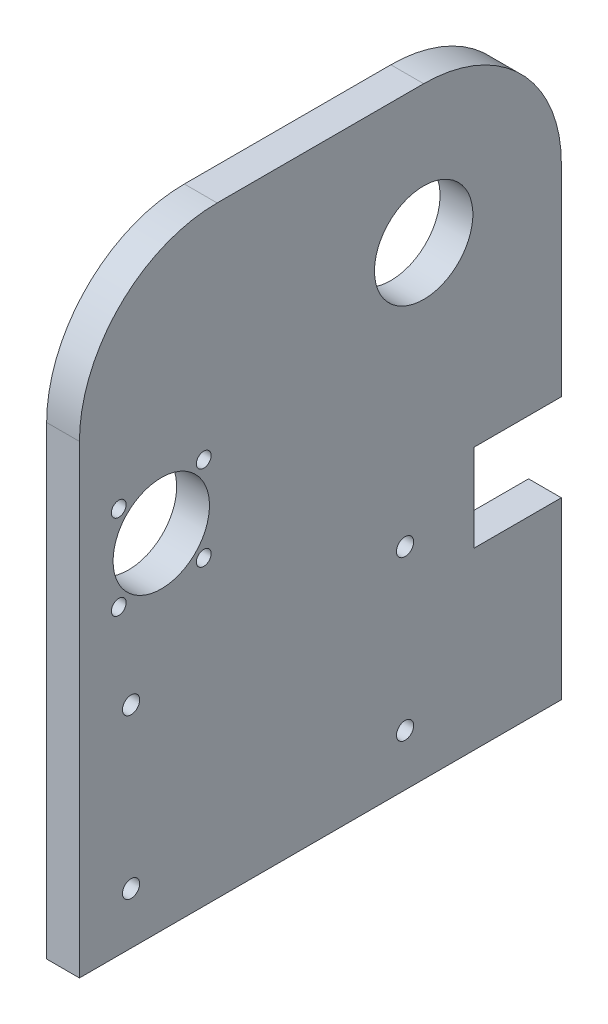
from build123d import *

# Parameters (mm, degrees)
SKETCH1_W             = 9.525
SKETCH1_H             = 140
BOSS_EXTRUDE1_DEPTH   = 87.5
SKETCH3_R             = 14.29
SKETCH3_R_2           = 2.15
SKETCH3_R_3           = 14
CUT_EXTRUDE2_DEPTH    = 28.575
SKETCH5_W             = 25.4
SKETCH5_H             = 25.4
CUT_EXTRUDE4_DEPTH    = 113.458773001
M6_TAPPED_HOLE1_D     = 5
M6_TAPPED_HOLE1_DEPTH = 10
M6_TAPPED_HOLE1_TIP   = 1.502151548
M6_TAPPED_HOLE2_D     = 5
FILLET1_R             = 40


with BuildPart() as part:
    # Sketch1 → Boss-Extrude1 (new, symmetric)
    with BuildSketch(Plane(origin=(0, 0, 0), x_dir=(1, 0, 0), z_dir=(0, 1, 0))):
        Rectangle(SKETCH1_W, SKETCH1_H)
    extrude(amount=BOSS_EXTRUDE1_DEPTH, both=True)

    # Sketch3 → Cut-Extrude2 (cut)
    with BuildSketch(Plane.ZY.offset(4.7625)):
        with Locations((-30, 47.5)):
            Circle(SKETCH3_R)
        with Locations((33.881108209, 24.847852166)):
            Circle(SKETCH3_R_2)
        with Locations((58.576812542, 24.847852166)):
            Circle(SKETCH3_R_2)
        with Locations((33.881108209, 0.152147834)):
            Circle(SKETCH3_R_2)
        with Locations((58.576812542, 0.152147834)):
            Circle(SKETCH3_R_2)
        with Locations((46.228960376, 12.5)):
            Circle(SKETCH3_R_3)
    extrude(amount=-CUT_EXTRUDE2_DEPTH, mode=Mode.SUBTRACT)

    # Sketch5 → Cut-Extrude4 (cut, through all)
    with BuildSketch(Plane.ZY.offset(4.7625)):
        with Locations((-57.3, -23.9746)):
            Rectangle(SKETCH5_W, SKETCH5_H)
    extrude(amount=-CUT_EXTRUDE4_DEPTH, mode=Mode.SUBTRACT)

    # M6 Tapped Hole1
    with Locations(Plane(origin=(0, 0, -44.6), x_dir=(-1, 0, 0), z_dir=(0, 0, -1))):
        with Locations((0, -23.9746)):
            Hole(M6_TAPPED_HOLE1_D / 2, depth=M6_TAPPED_HOLE1_DEPTH)
            with Locations((0, 0, -(M6_TAPPED_HOLE1_DEPTH + M6_TAPPED_HOLE1_TIP / 2))):  # 118° drill point
                Cone(0, M6_TAPPED_HOLE1_D / 2, M6_TAPPED_HOLE1_TIP, mode=Mode.SUBTRACT)

    # M6 Tapped Hole2 (through all)
    with Locations(Plane.ZY.offset(4.7625)):
        with Locations((-24.6, -26.2746), (55, -26.2746), (-24.6, -72.5), (55, -72.5)):
            Hole(M6_TAPPED_HOLE2_D / 2)

    # Fillet1
    fillet1_edges = [part.edges().sort_by_distance(p)[0] for p in [
        (0, 87.5, 70),
        (0, 87.5, -70),
    ]]
    fillet(fillet1_edges, radius=FILLET1_R)


solid = part.part
